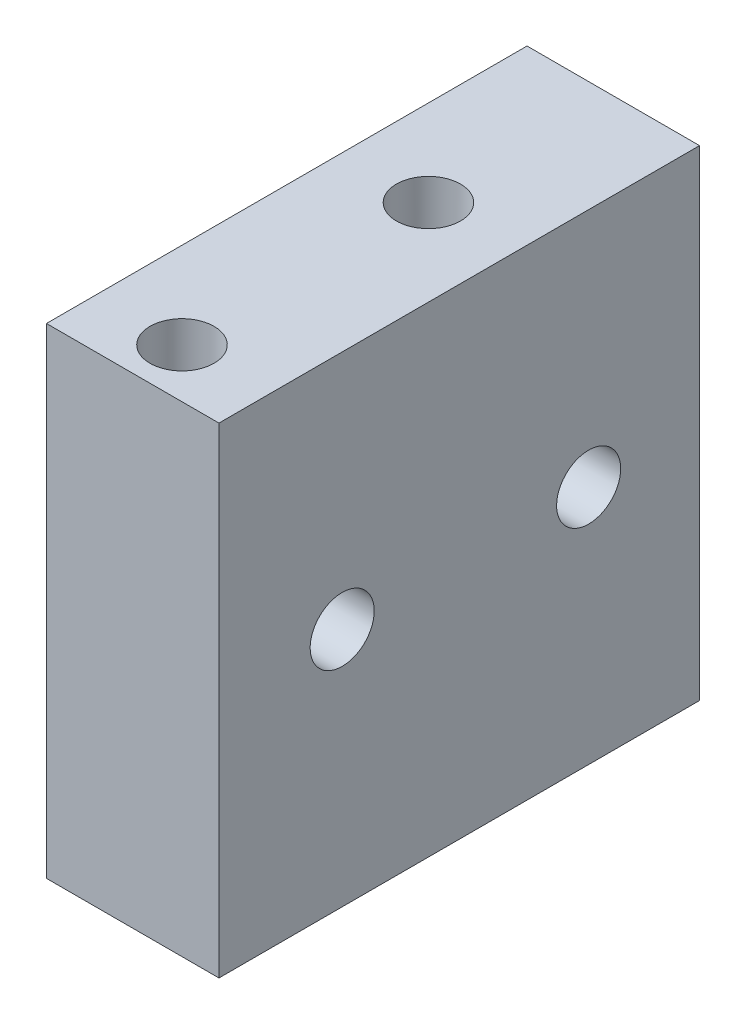
from build123d import *

# Parameters (mm, degrees)
ESQUISSE1_W            = 7
ESQUISSE1_H            = 19.5
MAIN_DEPTH             = 9.75
ESQUISSE2_R            = 1.3
SERVOFIXINGHOLES_DEPTH = 10
ESQUISSE3_R            = 1.3
SIDEHOLES_DEPTH        = 16.463667094
ESQUISSE4_R            = 1.3
TOPHOLES_DEPTH         = 23.080817467


with BuildPart() as part:
    # Esquisse1 → Main (new, symmetric)
    with BuildSketch(Plane.XY):
        Rectangle(ESQUISSE1_W, ESQUISSE1_H)
    extrude(amount=MAIN_DEPTH, both=True)

    # Esquisse2 → ServoFixingHoles (cut)
    with BuildSketch(Plane(origin=(0, 0, -9.75), x_dir=(-1, 0, 0), z_dir=(0, 0, -1))):
        with Locations((1.5, 4.75)):
            Circle(ESQUISSE2_R)
        with Locations((1.5, -4.75)):
            Circle(ESQUISSE2_R)
    extrude(amount=-SERVOFIXINGHOLES_DEPTH, mode=Mode.SUBTRACT)

    # Esquisse3 → SideHoles (cut, through all)
    with BuildSketch(Plane.ZY.offset(3.5)):
        with Locations((4.75, 0)):
            Circle(ESQUISSE3_R)
        with Locations((-5.25, 0)):
            Circle(ESQUISSE3_R)
    extrude(amount=-SIDEHOLES_DEPTH, mode=Mode.SUBTRACT)

    # Esquisse4 → TopHoles (cut, through all)
    with BuildSketch(Plane.XZ.offset(9.75)):
        with Locations((0, 7.75)):
            Circle(ESQUISSE4_R)
        with Locations((0, -2.25)):
            Circle(ESQUISSE4_R)
    extrude(amount=-TOPHOLES_DEPTH, mode=Mode.SUBTRACT)


solid = part.part
